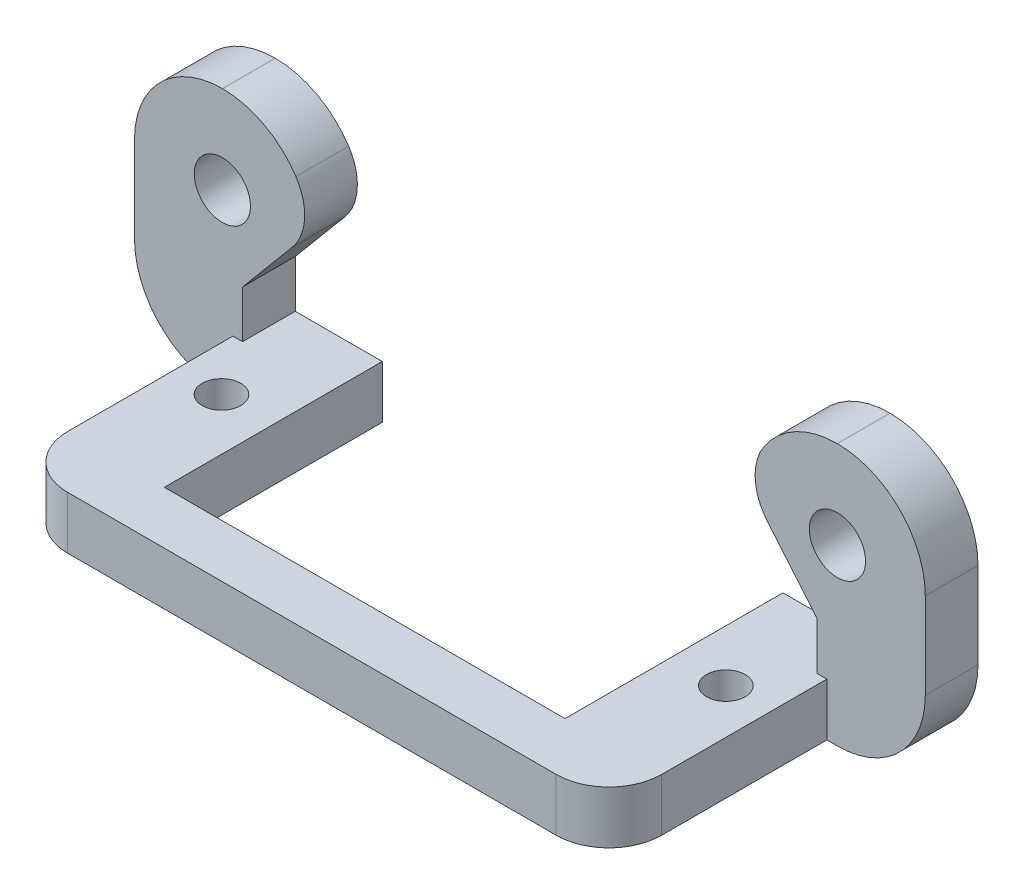
from build123d import *

# Parameters (mm, degrees)
SKETCH1_R           = 1.1
BOSS_EXTRUDE1_DEPTH = 3
FILLET1_R           = 3
SKETCH2_R           = 1.6
BOSS_EXTRUDE2_DEPTH = 3
FILLET2_R           = 5
FILLET3_R           = 3


with BuildPart() as part:
    # Sketch1 → Boss-Extrude1 (new body)
    with BuildSketch(Plane(origin=(0, 0, 0), x_dir=(1, 0, 0), z_dir=(0, 1, 0))):
        Polygon((-16.9, -9.2), (16.9, -9.2), (16.9, 6.2), (11.4, 6.2), (11.4, -6.2), (-11.4, -6.2), (-11.4, 6.2), (-16.9, 6.2), align=None)
        with Locations(Location((-14.35, 0, 0), (0, 0, 270))):
            Circle(SKETCH1_R, mode=Mode.SUBTRACT)
        with Locations(Location((14.35, 0, 0), (0, 0, 270))):
            Circle(SKETCH1_R, mode=Mode.SUBTRACT)
    extrude(amount=BOSS_EXTRUDE1_DEPTH)

    # Fillet1
    fillet1_edges = [part.edges().sort_by_distance(p)[0] for p in [
        (16.9, 1.5, 9.2),
        (-16.9, 1.5, 9.2),
    ]]
    fillet(fillet1_edges, radius=FILLET1_R)

    # Sketch2 → Boss-Extrude2 (add)
    # profile 1 of 2: a face of its own
    with BuildSketch(Plane(origin=(0, 0, -6.2), x_dir=(-1, 0, 0), z_dir=(0, 0, -1))):
        Polygon((-16.35, 3), (-16.35, 5.7), (-12.5, 10.288251331), (-12.5, 14.9), (-22.5, 14.9), (-22.5, 4.9), (-22.5, 0), (-16.9, 0), (-16.9, 3), align=None)
        with Locations((-17.5, 9.9)):
            Circle(SKETCH2_R, mode=Mode.SUBTRACT)
    # profile 2 of 2: a face of its own
    with BuildSketch(Plane(origin=(0, 0, -6.2), x_dir=(-1, 0, 0), z_dir=(0, 0, -1))):
        Polygon((22.5, 14.9), (22.5, 4.9), (22.5, 0), (16.9, 0), (16.9, 3), (16.35, 3), (16.35, 5.7), (12.5, 10.288251331), (12.5, 14.9), align=None)
        with Locations((17.5, 9.9)):
            Circle(SKETCH2_R, mode=Mode.SUBTRACT)
    extrude(amount=-BOSS_EXTRUDE2_DEPTH)

    # Fillet2
    # the kernel refuses this fillet: 5 mm, written as the material it takes off along each edge
    with BuildSketch(Plane(origin=(22.5, 0, -18.7), x_dir=(0, 1, 0), z_dir=(0, 0, 1)), Plane(origin=(-22.5, 14.9, -18.7), x_dir=(0, -1, 0), z_dir=(0, 0, 1))) as fillet2_piece_1:
        with BuildLine():
            CenterArc((FILLET2_R, FILLET2_R), FILLET2_R, 180, 90)
            Line((0, FILLET2_R), (-FILLET2_R * 0.02, FILLET2_R))
            Line((-FILLET2_R * 0.02, FILLET2_R), (-FILLET2_R * 0.02, -FILLET2_R * 0.02))
            Line((-FILLET2_R * 0.02, -FILLET2_R * 0.02), (FILLET2_R, -FILLET2_R * 0.02))
            Line((FILLET2_R, -FILLET2_R * 0.02), (FILLET2_R, 0))
        make_face()
    extrude(amount=28, mode=Mode.SUBTRACT)
    with BuildSketch(Plane(origin=(-22.5, 0, -18.7), x_dir=(0, 1, 0), z_dir=(0, 0, 1)), Plane(origin=(22.5, 14.9, -18.7), x_dir=(0, -1, 0), z_dir=(0, 0, 1))) as fillet2_piece_2:
        with BuildLine():
            CenterArc((FILLET2_R, -FILLET2_R), FILLET2_R, 90, 90)
            Line((0, -FILLET2_R), (-FILLET2_R * 0.02, -FILLET2_R))
            Line((-FILLET2_R * 0.02, -FILLET2_R), (-FILLET2_R * 0.02, FILLET2_R * 0.02))
            Line((-FILLET2_R * 0.02, FILLET2_R * 0.02), (FILLET2_R, FILLET2_R * 0.02))
            Line((FILLET2_R, FILLET2_R * 0.02), (FILLET2_R, 0))
        make_face()
    extrude(amount=28, mode=Mode.SUBTRACT)
    with BuildSketch(Plane(origin=(-12.5, 14.9, -18.662258248), x_dir=(-1, 0, 0), z_dir=(0, 0, 1))) as fillet2_piece_3:
        with BuildLine():
            CenterArc((4.984903299, 5), FILLET2_R, 184.453515666, 85.546484334)
            Line((0, 4.611748669), (-0.099698066, 4.603983642))
            ThreePointArc((-0.099698066, 4.603983642), (-0.1, 2.305874334), (-0.1, 0))
            Line((-0.1, 0), (0, -0.1))
            Line((0, -0.1), (4.984903299, -0.1))
            Line((4.984903299, -0.1), (4.984903299, 0))
        make_face()
    extrude(amount=27.924516497, mode=Mode.SUBTRACT)
    with BuildSketch(Plane(origin=(12.5, 14.9, -18.662258248), x_dir=(1, 0, 0), z_dir=(0, 0, 1))) as fillet2_piece_4:
        with BuildLine():
            CenterArc((4.984903299, -5), FILLET2_R, 90, 85.546484334)
            Line((0, -4.611748669), (-0.099698066, -4.603983642))
            ThreePointArc((-0.099698066, -4.603983642), (-0.1, -2.305874334), (-0.1, 0))
            Line((-0.1, 0), (0, 0.1))
            Line((0, 0.1), (4.984903299, 0.1))
            Line((4.984903299, 0.1), (4.984903299, 0))
        make_face()
    extrude(amount=27.924516497, mode=Mode.SUBTRACT)

    # Fillet3
    fillet3_edges = [part.edges().sort_by_distance(p)[0] for p in [
        (-12.5, 10.288251331, -4.7),
        (12.5, 10.288251331, -4.7),
    ]]
    fillet(fillet3_edges, radius=FILLET3_R)


solid = part.part
